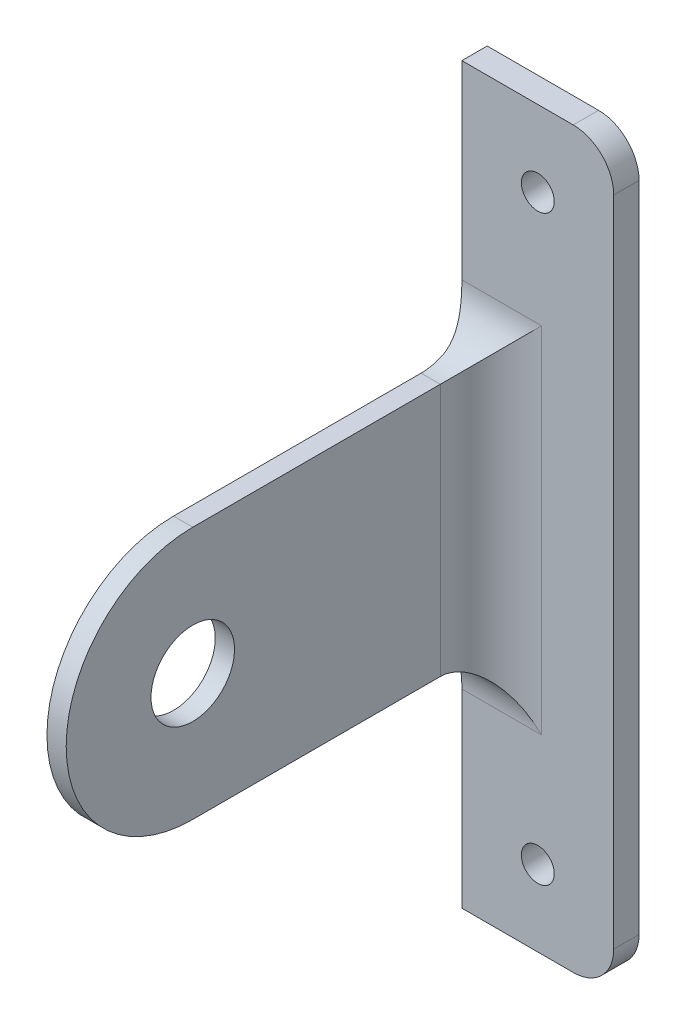
from build123d import *

# Parameters (mm, degrees)
SKETCH1_R               = 4.125
BOSS_EXTRUDE1_DEPTH     = 1.9
BOSS_EXTRUDE4_DEPTH     = 2.5
CUT_EXTRUDE2_REACH      = 80.314
SKETCH7_W               = 7
SKETCH7_H               = 16.5
SKETCH7_W_2             = 16
SKETCH7_H_2             = 8
CUT_EXTRUDE3_REACH      = 82.041
SKETCH9_W               = 1.9
SKETCH9_H               = 22.388822383
SKETCH8_W               = 1.9
SKETCH8_H               = 27.825
BOSS_EXTRUDE5_DEPTH     = 12.5
FILLET2_R               = 1
FILLET3_R               = 4
CUT_EXTRUDE4_DEPTH      = 74.103052287
CUT_EXTRUDE4_DEPTH_BACK = 74.103052287
SKETCH10_W              = 78.235731334
SKETCH10_H              = 6.290045588
SKETCH11_W              = 15
SKETCH11_H              = 2.5
BOSS_EXTRUDE6_DEPTH     = 12.5
BOSS_EXTRUDE7_DEPTH     = 2.5
SKETCH14_R              = 1.625
CUT_EXTRUDE5_DEPTH      = 2.5
FILLET4_R               = 5


with BuildPart() as part:
    # Sketch1 → Boss-Extrude1 (new body)
    with BuildSketch(Plane(origin=(0, 0, 0), x_dir=(0, 0, -1), z_dir=(1, 0, 0))):
        with BuildLine():
            Line((0, 12.5), (34.45, 12.5))
            Line((34.45, 12.5), (34.45, -12.5))
            Line((34.45, -12.5), (0, -12.5))
            ThreePointArc((0, -12.5), (-12.5, 0), (0, 12.5))
        make_face()
        with Locations(Location((0, 0, 0), (0, 0, 180))):
            Circle(SKETCH1_R, mode=Mode.SUBTRACT)
    extrude(amount=BOSS_EXTRUDE1_DEPTH)

    # Sketch6 → Boss-Extrude4 (add)
    with BuildSketch(Plane(origin=(0, 0, -34.45), x_dir=(-1, 0, 0), z_dir=(0, 0, -1))):
        Polygon((-8.812505246, 36.25), (53.321583376, 36.25), (53.321583376, -36.25), (6.25, -36.25), (-19.178416624, -36.25), (-19.178416624, 36.25), align=None)
    extrude(amount=-BOSS_EXTRUDE4_DEPTH)

    # Sketch7 → Cut-Extrude2 (cut, up to next)
    with BuildSketch(Plane.XY.offset(-31.95), mode=Mode.PRIVATE) as cut_extrude2_sk1:
        with Locations((-1.711858899, -11.632438111)):
            Rectangle(SKETCH7_W, SKETCH7_H)
    cut_extrude2_tool1 = extrude(cut_extrude2_sk1.sketch, amount=-CUT_EXTRUDE2_REACH, mode=Mode.PRIVATE) & part.part
    # Sketch7 → Cut-Extrude2 (cut, up to next)
    with BuildSketch(Plane.XY.offset(-31.95), mode=Mode.PRIVATE) as cut_extrude2_sk2:
        with Locations((-16.5, 0)):
            Rectangle(SKETCH7_W_2, SKETCH7_H_2)
    cut_extrude2_tool2 = extrude(cut_extrude2_sk2.sketch, amount=-CUT_EXTRUDE2_REACH, mode=Mode.PRIVATE) & part.part
    add(cut_extrude2_tool1.solids().sort_by_distance((-1.711859, -11.632438, -31.95))[0], mode=Mode.SUBTRACT)
    add(cut_extrude2_tool2.solids().sort_by_distance((-16.5, 0, -31.95))[0], mode=Mode.SUBTRACT)

    # Sketch9 → Cut-Extrude3 (cut, up to next)
    with BuildSketch(Plane.XZ.offset(12.5), mode=Mode.PRIVATE) as cut_extrude3_sk1:
        with Locations((0.95, -20.755588809)):
            Rectangle(SKETCH9_W, SKETCH9_H)
    cut_extrude3_tool1 = extrude(cut_extrude3_sk1.sketch, amount=-CUT_EXTRUDE3_REACH, mode=Mode.PRIVATE) & part.part
    add(cut_extrude3_tool1.solids().sort_by_distance((0.95, -12.5, -20.755589))[0], mode=Mode.SUBTRACT)


with BuildPart() as cut_extrude3_piece_1:
    # of the separate pieces the step leaves, piece 1, a body of its own (cut_extrude3_pieces)
    add(part.part.solids().sort_by_distance((-53.321583376, 36.25, -31.95))[0])



with BuildPart() as cut_extrude3_piece_2:
    # of the separate pieces the step leaves, piece 2, a body of its own (cut_extrude3_pieces)
    add(part.part.solids().sort_by_distance((0, 12.5, 0))[0])


with BuildPart() as cut_extrude3_piece_1_1:
    add(cut_extrude3_piece_1.part)

    add(cut_extrude3_piece_2.part)  # Boss-Extrude5 merges Cut-Extrude3 piece 2
    # Sketch8 → Boss-Extrude5 (add, symmetric)
    with BuildSketch(Plane(origin=(0, 0, 0), x_dir=(1, 0, 0), z_dir=(0, 1, 0))):
        with Locations((0.95, 18.0375)):
            Rectangle(SKETCH8_W, SKETCH8_H)
    extrude(amount=BOSS_EXTRUDE5_DEPTH, both=True)

    # Fillet2
    fillet2_edges = [cut_extrude3_piece_1_1.edges().sort_by_distance(p)[0] for p in [
        (-8.5, 4, -33.2),
        (-8.5, -4, -33.2),
        (-24.5, -4, -33.2),
        (-24.5, 4, -33.2),
        (-5.211858899, -19.882438111, -33.2),
        (-5.211858899, -3.382438111, -33.2),
        (1.788141101, -3.382438111, -33.2),
        (1.788141101, -19.882438111, -33.2),
    ]]
    fillet(fillet2_edges, radius=FILLET2_R)

    # Fillet3
    fillet3_edges = [cut_extrude3_piece_1_1.edges().sort_by_distance(p)[0] for p in [
        (19.178416624, 36.25, -33.2),
        (-53.321583376, 36.25, -33.2),
        (-53.321583376, -36.25, -33.2),
        (19.178416624, -36.25, -33.2),
    ]]
    fillet(fillet3_edges, radius=FILLET3_R)

    # Sketch10 → Cut-Extrude4 (cut, two sides: drawn at the far end of the back side and taken through both)
    with BuildSketch(Plane(origin=(0, 0, 0), x_dir=(1, 0, 0), z_dir=(0, 1, 0)).offset(-CUT_EXTRUDE4_DEPTH_BACK)):
        with Locations((-17.391929865, 35.095022794)):
            Rectangle(SKETCH10_W, SKETCH10_H)
    extrude(amount=CUT_EXTRUDE4_DEPTH + CUT_EXTRUDE4_DEPTH_BACK, mode=Mode.SUBTRACT)

    # Sketch11 → Boss-Extrude6 (add, symmetric)
    with BuildSketch(Plane(origin=(0, 0, 0), x_dir=(1, 0, 0), z_dir=(0, 1, 0))):
        with Locations((6.53, 30.7)):
            Rectangle(SKETCH11_W, SKETCH11_H)
    boss_extrude6 = extrude(amount=BOSS_EXTRUDE6_DEPTH, both=True)

    # Sketch13 → Boss-Extrude7 (add)
    with BuildSketch(Plane(origin=(0, 0, -31.95), x_dir=(-1, 0, 0), z_dir=(0, 0, -1))):
        with BuildLine():
            Line((-14.03, 12.5), (0.97, 12.5))
            Line((0.97, 12.5), (0.97, 36.25))
            Line((0.97, 36.25), (-10.03, 36.25))
            ThreePointArc((-10.03, 36.25), (-12.858427125, 35.078427125), (-14.03, 32.25))
            Line((-14.03, 32.25), (-14.03, 12.5))
        make_face()
    boss_extrude7 = extrude(amount=-BOSS_EXTRUDE7_DEPTH)

    # Mirror1: Boss-Extrude6, Boss-Extrude7 across plane
    add(boss_extrude6.mirror(Plane.ZX))
    add(boss_extrude7.mirror(Plane.ZX))

    # Sketch14 → Cut-Extrude5 (cut)
    with BuildSketch(Plane(origin=(0, 0, -31.95), x_dir=(-1, 0, 0), z_dir=(0, 0, -1))):
        with Locations((-6.53, 28.75)):
            Circle(SKETCH14_R)
    cut_extrude5 = extrude(amount=-CUT_EXTRUDE5_DEPTH, mode=Mode.SUBTRACT)

    # Mirror2: Cut-Extrude5 across plane
    add(cut_extrude5.mirror(Plane.ZX), mode=Mode.SUBTRACT)

    # Fillet4
    # the kernel refuses this fillet: 5 mm, written as the material it adds along each edge
    with BuildSketch(Plane(origin=(1.9, -12.5, -29.45), x_dir=(1, 0, 0), z_dir=(0, 1, 0))) as fillet4_piece_1:
        with BuildLine():
            CenterArc((FILLET4_R, -FILLET4_R), FILLET4_R, 90, 90)
            Line((0, -FILLET4_R), (-FILLET4_R * 0.02, -FILLET4_R))
            Line((-FILLET4_R * 0.02, -FILLET4_R), (-FILLET4_R * 0.02, FILLET4_R * 0.02))
            Line((-FILLET4_R * 0.02, FILLET4_R * 0.02), (FILLET4_R, FILLET4_R * 0.02))
            Line((FILLET4_R, FILLET4_R * 0.02), (FILLET4_R, 0))
        make_face()
    extrude(amount=25)
    with BuildSketch(Plane(origin=(0, -12.5, -29.45), x_dir=(-1, 0, 0), z_dir=(0, 1, 0))) as fillet4_piece_2:
        with BuildLine():
            CenterArc((5, 2.959577673), FILLET4_R, 180, 36.293058493)
            Line((0, 2.959577673), (-0.1, 2.959577673))
            Line((-0.1, 2.959577673), (-0.1, 0))
            Line((-0.1, 0), (0, -0.1))
            ThreePointArc((0, -0.1), (0.485, -0.1), (0.8894, -0.059191553))
            Line((0.8894, -0.059191553), (0.97, 0))
        make_face()
    extrude(amount=25)
    with BuildSketch(Plane(origin=(1.9, 12.5, -29.45), x_dir=(0, 0, 1), z_dir=(-1, 0, 0)), Plane(origin=(1.9, -12.5, -29.45), x_dir=(0, -1, 0), z_dir=(-1, 0, 0))) as fillet4_piece_3:
        with BuildLine():
            CenterArc((FILLET4_R, FILLET4_R), FILLET4_R, 180, 90)
            Line((0, FILLET4_R), (-FILLET4_R * 0.02, FILLET4_R))
            Line((-FILLET4_R * 0.02, FILLET4_R), (-FILLET4_R * 0.02, -FILLET4_R * 0.02))
            Line((-FILLET4_R * 0.02, -FILLET4_R * 0.02), (FILLET4_R, -FILLET4_R * 0.02))
            Line((FILLET4_R, -FILLET4_R * 0.02), (FILLET4_R, 0))
        make_face()
    extrude(amount=1.9)
    with BuildSketch(Plane(origin=(1.9, -25, -29.45), x_dir=(1, 0, 0), z_dir=(0, 1, 0))) as fillet4_piece_4a_section:
        with BuildLine():
            CenterArc((FILLET4_R, -FILLET4_R), FILLET4_R, 90, 90)
            Line((0, -FILLET4_R), (-FILLET4_R * 0.02, -FILLET4_R))
            Line((-FILLET4_R * 0.02, -FILLET4_R), (-FILLET4_R * 0.02, FILLET4_R * 0.02))
            Line((-FILLET4_R * 0.02, FILLET4_R * 0.02), (FILLET4_R, FILLET4_R * 0.02))
            Line((FILLET4_R, FILLET4_R * 0.02), (FILLET4_R, 0))
        make_face()
    fillet4_piece_4a = extrude(amount=37.5, mode=Mode.PRIVATE)
    fillet4_piece_4a = split(fillet4_piece_4a, bisect_by=Plane(origin=(3.031975571, -12.5, -28.318024429), z_dir=(0, -1, 0)), keep=Keep.TOP, mode=Mode.PRIVATE)
    with BuildSketch(Plane(origin=(14.4, -12.5, -29.45), x_dir=(0, -1, 0), z_dir=(-1, 0, 0))) as fillet4_piece_4b_section:
        with BuildLine():
            CenterArc((FILLET4_R, FILLET4_R), FILLET4_R, 180, 90)
            Line((0, FILLET4_R), (-FILLET4_R * 0.02, FILLET4_R))
            Line((-FILLET4_R * 0.02, FILLET4_R), (-FILLET4_R * 0.02, -FILLET4_R * 0.02))
            Line((-FILLET4_R * 0.02, -FILLET4_R * 0.02), (FILLET4_R, -FILLET4_R * 0.02))
            Line((FILLET4_R, -FILLET4_R * 0.02), (FILLET4_R, 0))
        make_face()
    fillet4_piece_4b = extrude(amount=14.4, mode=Mode.PRIVATE)
    fillet4_piece_4b = split(fillet4_piece_4b, bisect_by=Plane(origin=(14.03, -13.631975571, -28.318024429), z_dir=(-1, 0, 0)), keep=Keep.TOP, mode=Mode.PRIVATE)
    fillet4_piece_4b = split(fillet4_piece_4b, bisect_by=Plane(origin=(1.9, -13.631975571, -28.318024429), z_dir=(1, 0, 0)), keep=Keep.TOP, mode=Mode.PRIVATE)
    fillet4_piece_4 = fillet4_piece_4a & fillet4_piece_4b
    add(fillet4_piece_4)
    with BuildSketch(Plane(origin=(14.4, 12.5, -29.45), x_dir=(0, 0, 1), z_dir=(-1, 0, 0))) as fillet4_piece_5a_section:
        with BuildLine():
            CenterArc((FILLET4_R, FILLET4_R), FILLET4_R, 180, 90)
            Line((0, FILLET4_R), (-FILLET4_R * 0.02, FILLET4_R))
            Line((-FILLET4_R * 0.02, FILLET4_R), (-FILLET4_R * 0.02, -FILLET4_R * 0.02))
            Line((-FILLET4_R * 0.02, -FILLET4_R * 0.02), (FILLET4_R, -FILLET4_R * 0.02))
            Line((FILLET4_R, -FILLET4_R * 0.02), (FILLET4_R, 0))
        make_face()
    fillet4_piece_5a = extrude(amount=14.4, mode=Mode.PRIVATE)
    fillet4_piece_5a = split(fillet4_piece_5a, bisect_by=Plane(origin=(1.9, 13.631975571, -28.318024429), z_dir=(1, 0, 0)), keep=Keep.TOP, mode=Mode.PRIVATE)
    fillet4_piece_5a = split(fillet4_piece_5a, bisect_by=Plane(origin=(14.03, 13.631975571, -28.318024429), z_dir=(-1, 0, 0)), keep=Keep.TOP, mode=Mode.PRIVATE)
    with BuildSketch(Plane(origin=(1.9, -12.5, -29.45), x_dir=(1, 0, 0), z_dir=(0, 1, 0))) as fillet4_piece_5b_section:
        with BuildLine():
            CenterArc((FILLET4_R, -FILLET4_R), FILLET4_R, 90, 90)
            Line((0, -FILLET4_R), (-FILLET4_R * 0.02, -FILLET4_R))
            Line((-FILLET4_R * 0.02, -FILLET4_R), (-FILLET4_R * 0.02, FILLET4_R * 0.02))
            Line((-FILLET4_R * 0.02, FILLET4_R * 0.02), (FILLET4_R, FILLET4_R * 0.02))
            Line((FILLET4_R, FILLET4_R * 0.02), (FILLET4_R, 0))
        make_face()
    fillet4_piece_5b = extrude(amount=37.5, mode=Mode.PRIVATE)
    fillet4_piece_5b = split(fillet4_piece_5b, bisect_by=Plane(origin=(3.031975571, 12.5, -28.318024429), z_dir=(0, 1, 0)), keep=Keep.TOP, mode=Mode.PRIVATE)
    fillet4_piece_5 = fillet4_piece_5a & fillet4_piece_5b
    add(fillet4_piece_5)
    with BuildSketch(Plane(origin=(1.9, -12.5, -29.45), x_dir=(0, -1, 0), z_dir=(-1, 0, 0))) as fillet4_piece_6a_section:
        with BuildLine():
            CenterArc((FILLET4_R, FILLET4_R), FILLET4_R, 180, 90)
            Line((0, FILLET4_R), (-FILLET4_R * 0.02, FILLET4_R))
            Line((-FILLET4_R * 0.02, FILLET4_R), (-FILLET4_R * 0.02, -FILLET4_R * 0.02))
            Line((-FILLET4_R * 0.02, -FILLET4_R * 0.02), (FILLET4_R, -FILLET4_R * 0.02))
            Line((FILLET4_R, -FILLET4_R * 0.02), (FILLET4_R, 0))
        make_face()
    fillet4_piece_6a = extrude(amount=14.4, mode=Mode.PRIVATE)
    fillet4_piece_6a = split(fillet4_piece_6a, bisect_by=Plane(origin=(-0.97, -13.631975571, -28.318024429), z_dir=(1, 0, 0)), keep=Keep.TOP, mode=Mode.PRIVATE)
    fillet4_piece_6a = split(fillet4_piece_6a, bisect_by=Plane(origin=(0, -13.631975571, -28.318024429), z_dir=(-1, 0, 0)), keep=Keep.TOP, mode=Mode.PRIVATE)
    with BuildSketch(Plane(origin=(0, -19.898944181, -29.45), x_dir=(-1, 0, 0), z_dir=(0, 1, 0))) as fillet4_piece_6b_section:
        with BuildLine():
            CenterArc((5, 2.959577673), FILLET4_R, 180, 36.293058493)
            Line((0, 2.959577673), (-0.1, 2.959577673))
            Line((-0.1, 2.959577673), (-0.1, 0))
            Line((-0.1, 0), (0, -0.1))
            ThreePointArc((0, -0.1), (0.485, -0.1), (0.8894, -0.059191553))
            Line((0.8894, -0.059191553), (0.97, 0))
        make_face()
    fillet4_piece_6b = extrude(amount=32.398944181, mode=Mode.PRIVATE)
    fillet4_piece_6b = split(fillet4_piece_6b, bisect_by=Plane(origin=(-0.217435867, -12.5, -28.607978011), z_dir=(0, -1, 0)), keep=Keep.TOP, mode=Mode.PRIVATE)
    fillet4_piece_6 = fillet4_piece_6a & fillet4_piece_6b
    add(fillet4_piece_6)
    with BuildSketch(Plane(origin=(1.9, 12.5, -29.45), x_dir=(0, 0, 1), z_dir=(-1, 0, 0))) as fillet4_piece_7a_section:
        with BuildLine():
            CenterArc((FILLET4_R, FILLET4_R), FILLET4_R, 180, 90)
            Line((0, FILLET4_R), (-FILLET4_R * 0.02, FILLET4_R))
            Line((-FILLET4_R * 0.02, FILLET4_R), (-FILLET4_R * 0.02, -FILLET4_R * 0.02))
            Line((-FILLET4_R * 0.02, -FILLET4_R * 0.02), (FILLET4_R, -FILLET4_R * 0.02))
            Line((FILLET4_R, -FILLET4_R * 0.02), (FILLET4_R, 0))
        make_face()
    fillet4_piece_7a = extrude(amount=14.4, mode=Mode.PRIVATE)
    fillet4_piece_7a = split(fillet4_piece_7a, bisect_by=Plane(origin=(0, 13.631975571, -28.318024429), z_dir=(-1, 0, 0)), keep=Keep.TOP, mode=Mode.PRIVATE)
    fillet4_piece_7a = split(fillet4_piece_7a, bisect_by=Plane(origin=(-0.97, 13.631975571, -28.318024429), z_dir=(1, 0, 0)), keep=Keep.TOP, mode=Mode.PRIVATE)
    with BuildSketch(Plane(origin=(0, -12.5, -29.45), x_dir=(-1, 0, 0), z_dir=(0, 1, 0))) as fillet4_piece_7b_section:
        with BuildLine():
            CenterArc((5, 2.959577673), FILLET4_R, 180, 36.293058493)
            Line((0, 2.959577673), (-0.1, 2.959577673))
            Line((-0.1, 2.959577673), (-0.1, 0))
            Line((-0.1, 0), (0, -0.1))
            ThreePointArc((0, -0.1), (0.485, -0.1), (0.8894, -0.059191553))
            Line((0.8894, -0.059191553), (0.97, 0))
        make_face()
    fillet4_piece_7b = extrude(amount=32.398944181, mode=Mode.PRIVATE)
    fillet4_piece_7b = split(fillet4_piece_7b, bisect_by=Plane(origin=(-0.217435867, 12.5, -28.607978011), z_dir=(0, 1, 0)), keep=Keep.TOP, mode=Mode.PRIVATE)
    fillet4_piece_7 = fillet4_piece_7a & fillet4_piece_7b
    add(fillet4_piece_7)


solid = cut_extrude3_piece_1_1.part
